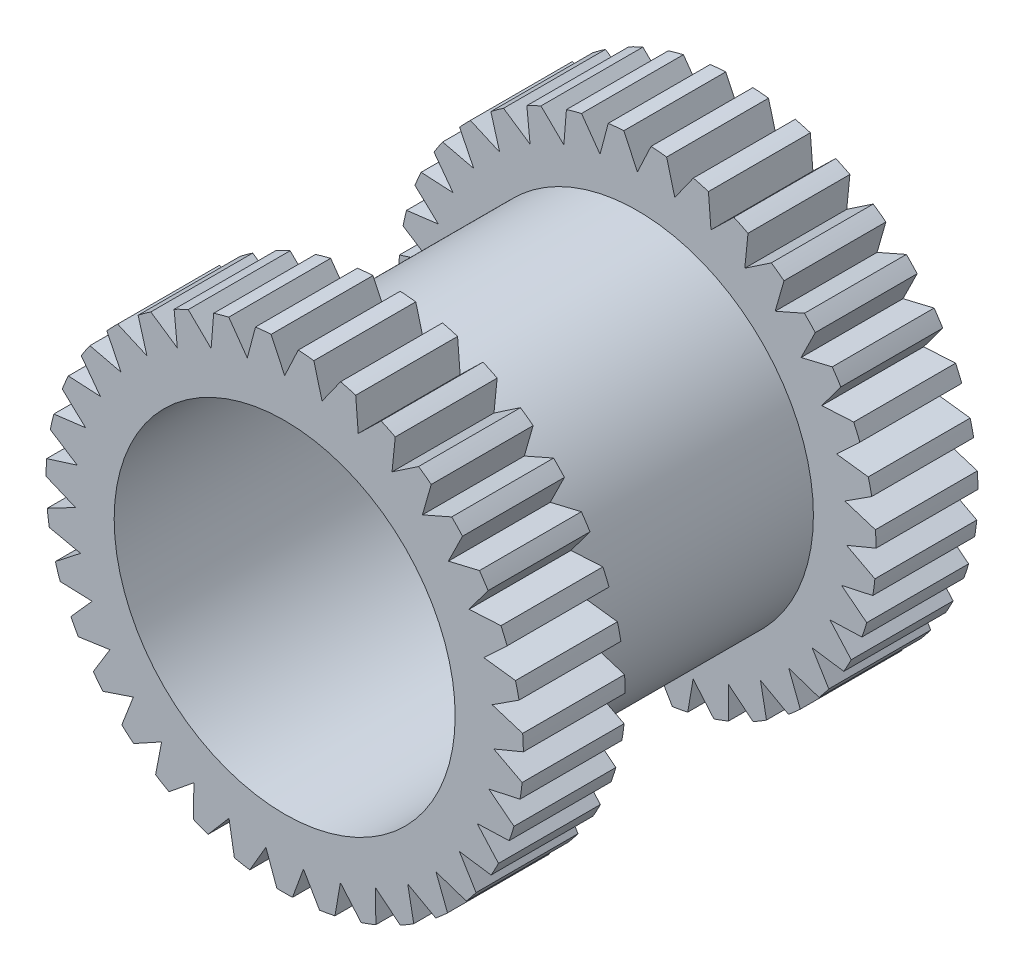
from build123d import *

# Parameters (mm, degrees)
CUT_EXTRUDE1_DEPTH       = 0.65
CUT_EXTRUDE2_DEPTH       = 0.65
CUT_EXTRUDE3_DEPTH       = 0.65
CUT_EXTRUDE4_DEPTH       = 0.65
CUT_EXTRUDE5_DEPTH       = 0.65
CUT_EXTRUDE6_DEPTH       = 0.65
CUT_EXTRUDE7_DEPTH       = 0.65
CUT_EXTRUDE8_DEPTH       = 0.65
CUT_EXTRUDE9_DEPTH       = 0.65
CUT_EXTRUDE10_DEPTH      = 0.65
CUT_EXTRUDE11_DEPTH      = 0.65
CUT_EXTRUDE12_DEPTH      = 0.65
CUT_EXTRUDE13_DEPTH      = 0.65
CUT_EXTRUDE14_DEPTH      = 0.65
CUT_EXTRUDE15_DEPTH      = 0.65
CUT_EXTRUDE16_DEPTH      = 0.65
CUT_EXTRUDE17_DEPTH      = 0.65
CUT_EXTRUDE18_DEPTH      = 0.65
CUT_EXTRUDE19_DEPTH      = 0.65
CUT_EXTRUDE20_DEPTH      = 0.65
CUT_EXTRUDE21_DEPTH      = 0.65
CUT_EXTRUDE22_DEPTH      = 0.65
CUT_EXTRUDE23_DEPTH      = 0.65
CUT_EXTRUDE24_DEPTH      = 0.65
CUT_EXTRUDE25_DEPTH      = 0.65
CUT_EXTRUDE26_DEPTH      = 0.65
CUT_EXTRUDE27_DEPTH      = 0.65
CUT_EXTRUDE28_DEPTH      = 0.65
CUT_EXTRUDE29_DEPTH      = 0.65
CUT_EXTRUDE30_DEPTH      = 0.65
CUT_EXTRUDE31_DEPTH      = 0.65
CUT_EXTRUDE32_DEPTH      = 0.65
CUT_EXTRUDE33_DEPTH      = 0.65
CUT_EXTRUDE34_DEPTH      = 0.65
CUT_EXTRUDE35_DEPTH      = 0.65
CUT_EXTRUDE36_START      = -0.65
CUT_EXTRUDE36_DEPTH      = 0.65
CUT_EXTRUDE37_START      = -0.65
CUT_EXTRUDE37_DEPTH      = 0.65
CUT_EXTRUDE38_START      = -0.65
CUT_EXTRUDE38_DEPTH      = 0.65
CUT_EXTRUDE39_START      = -0.65
CUT_EXTRUDE39_DEPTH      = 0.65
CUT_EXTRUDE40_START      = -0.65
CUT_EXTRUDE40_DEPTH      = 0.65
CUT_EXTRUDE41_START      = -0.65
CUT_EXTRUDE41_DEPTH      = 0.65
CUT_EXTRUDE42_START      = -0.65
CUT_EXTRUDE42_DEPTH      = 0.65
CUT_EXTRUDE43_START      = -0.65
CUT_EXTRUDE43_DEPTH      = 0.65
CUT_EXTRUDE44_START      = -0.65
CUT_EXTRUDE44_DEPTH      = 0.65
CUT_EXTRUDE45_START      = -0.65
CUT_EXTRUDE45_DEPTH      = 0.65
CUT_EXTRUDE46_START      = -0.65
CUT_EXTRUDE46_DEPTH      = 0.65
CUT_EXTRUDE47_START      = -0.65
CUT_EXTRUDE47_DEPTH      = 0.65
CUT_EXTRUDE48_START      = -0.65
CUT_EXTRUDE48_DEPTH      = 0.65
CUT_EXTRUDE49_START      = -0.65
CUT_EXTRUDE49_DEPTH      = 0.65
CUT_EXTRUDE50_START      = -0.65
CUT_EXTRUDE50_DEPTH      = 0.65
CUT_EXTRUDE51_START      = -0.65
CUT_EXTRUDE51_DEPTH      = 0.65
CUT_EXTRUDE52_START      = -0.65
CUT_EXTRUDE52_DEPTH      = 0.65
CUT_EXTRUDE53_START      = -0.65
CUT_EXTRUDE53_DEPTH      = 0.65
CUT_EXTRUDE54_START      = -0.65
CUT_EXTRUDE54_DEPTH      = 0.65
CUT_EXTRUDE55_START      = -0.65
CUT_EXTRUDE55_DEPTH      = 0.65
CUT_EXTRUDE56_START      = -0.65
CUT_EXTRUDE56_DEPTH      = 0.65
CUT_EXTRUDE57_START      = -0.65
CUT_EXTRUDE57_DEPTH      = 0.65
CUT_EXTRUDE58_START      = -0.65
CUT_EXTRUDE58_DEPTH      = 0.65
CUT_EXTRUDE59_START      = -0.65
CUT_EXTRUDE59_DEPTH      = 0.65
CUT_EXTRUDE60_START      = -0.65
CUT_EXTRUDE60_DEPTH      = 0.65
CUT_EXTRUDE61_START      = -0.65
CUT_EXTRUDE61_DEPTH      = 0.65
CUT_EXTRUDE62_START      = -0.65
CUT_EXTRUDE62_DEPTH      = 0.65
CUT_EXTRUDE63_START      = -0.65
CUT_EXTRUDE63_DEPTH      = 0.65
CUT_EXTRUDE64_START      = -0.65
CUT_EXTRUDE64_DEPTH      = 0.65
CUT_EXTRUDE65_START      = -0.65
CUT_EXTRUDE65_DEPTH      = 0.65
CUT_EXTRUDE66_START      = -0.65
CUT_EXTRUDE66_DEPTH      = 0.65
CUT_EXTRUDE67_START      = -0.65
CUT_EXTRUDE67_DEPTH      = 0.65
CUT_EXTRUDE68_START      = -0.65
CUT_EXTRUDE68_DEPTH      = 0.65
CUT_EXTRUDE69_START      = -0.65
CUT_EXTRUDE69_DEPTH      = 0.65
CUT_EXTRUDE70_START      = -0.65
CUT_EXTRUDE70_DEPTH      = 0.65
F_3_0_3_DIAMETER_HOLE1_D = 3
CUT_EXTRUDE71_DEPTH      = 10


with BuildPart() as part:
    # Sketch1 → Revolve1 (revolve)
    with BuildSketch(Plane(origin=(0, 0, 0), x_dir=(1, 0, 0), z_dir=(0, 1, 0))):
        Polygon((2.1, 2), (0, 2), (0, -2), (2.1, -2), (2.1, -1.103448276), (1.548275862, -1.103448276), (1.548275862, 1.103448276), (2.1, 1.103448276), align=None)
    revolve(axis=Axis((0, 0, -2), (0, 0, 1)))

    # Sketch2 → Cut-Extrude1 (cut)
    with BuildSketch(Plane(origin=(0, 0, -2), x_dir=(-1, 0, 0), z_dir=(0, 0, -1))):
        with BuildLine():
            Line((0.673012439, -1.989234591), (0.490007971, -1.775504008))
            Line((0.490007971, -1.775504008), (0.442530268, -2.052843628))
            ThreePointArc((0.442530268, -2.052843628), (0.558677376, -2.024322007), (0.673012439, -1.989234591))
        make_face()
    extrude(amount=-CUT_EXTRUDE1_DEPTH, mode=Mode.SUBTRACT)

    # Sketch3 → Cut-Extrude2 (cut)
    with BuildSketch(Plane(origin=(0, 0, -2), x_dir=(-1, 0, 0), z_dir=(0, 0, -1))):
        with BuildLine():
            Line((0.3070053, -2.077437784), (0.165104859, -1.83446523))
            Line((0.165104859, -1.83446523), (0.068869241, -2.098870417))
            ThreePointArc((0.068869241, -2.098870417), (0.188242549, -2.091546017), (0.3070053, -2.077437784))
        make_face()
    extrude(amount=-CUT_EXTRUDE2_DEPTH, mode=Mode.SUBTRACT)

    # Sketch4 → Cut-Extrude3 (cut)
    with BuildSketch(Plane(origin=(0, 0, -2), x_dir=(-1, 0, 0), z_dir=(0, 0, -1))):
        with BuildLine():
            Line((-0.068869241, -2.098870417), (-0.165104859, -1.83446523))
            Line((-0.165104859, -1.83446523), (-0.3070053, -2.077437784))
            ThreePointArc((-0.3070053, -2.077437784), (-0.188242549, -2.091546017), (-0.068869241, -2.098870417))
        make_face()
    extrude(amount=-CUT_EXTRUDE3_DEPTH, mode=Mode.SUBTRACT)

    # Sketch5 → Cut-Extrude4 (cut)
    with BuildSketch(Plane(origin=(0, 0, -2), x_dir=(-1, 0, 0), z_dir=(0, 0, -1))):
        with BuildLine():
            Line((-0.442530268, -2.052843628), (-0.490007971, -1.775504008))
            Line((-0.490007971, -1.775504008), (-0.673012439, -1.989234591))
            ThreePointArc((-0.673012439, -1.989234591), (-0.558677376, -2.024322007), (-0.442530268, -2.052843628))
        make_face()
    extrude(amount=-CUT_EXTRUDE4_DEPTH, mode=Mode.SUBTRACT)

    # Sketch6 → Cut-Extrude5 (cut)
    with BuildSketch(Plane(origin=(0, 0, -2), x_dir=(-1, 0, 0), z_dir=(0, 0, -1))):
        with BuildLine():
            Line((-0.801968009, -1.940836756), (-0.799161824, -1.659476626))
            Line((-0.799161824, -1.659476626), (-1.017388403, -1.837095761))
            ThreePointArc((-1.017388403, -1.837095761), (-0.911155852, -1.892034623), (-0.801968009, -1.940836756))
        make_face()
    extrude(amount=-CUT_EXTRUDE5_DEPTH, mode=Mode.SUBTRACT)

    # Sketch7 → Cut-Extrude6 (cut)
    with BuildSketch(Plane(origin=(0, 0, -2), x_dir=(-1, 0, 0), z_dir=(0, 0, -1))):
        with BuildLine():
            Line((-1.135629837, -1.766449794), (-1.082629958, -1.4901123))
            Line((-1.082629958, -1.4901123), (-1.329064668, -1.625911163))
            ThreePointArc((-1.329064668, -1.625911163), (-1.23434903, -1.698935688), (-1.135629837, -1.766449794))
        make_face()
    extrude(amount=-CUT_EXTRUDE6_DEPTH, mode=Mode.SUBTRACT)

    # Sketch8 → Cut-Extrude7 (cut)
    with BuildSketch(Plane(origin=(0, 0, -2), x_dir=(-1, 0, 0), z_dir=(0, 0, -1))):
        with BuildLine():
            Line((-1.432791588, -1.535287681), (-1.331301474, -1.272854539))
            Line((-1.331301474, -1.272854539), (-1.5980237, -1.362468441))
            ThreePointArc((-1.5980237, -1.362468441), (-1.517869214, -1.451231563), (-1.432791588, -1.535287681))
        make_face()
    extrude(amount=-CUT_EXTRUDE7_DEPTH, mode=Mode.SUBTRACT)

    # Sketch9 → Cut-Extrude8 (cut)
    with BuildSketch(Plane(origin=(0, 0, -2), x_dir=(-1, 0, 0), z_dir=(0, 0, -1))):
        with BuildLine():
            Line((-1.683902239, -1.25478016), (-1.537183866, -1.014686186))
            Line((-1.537183866, -1.014686186), (-1.815620936, -1.055234863))
            ThreePointArc((-1.815620936, -1.055234863), (-1.752603833, -1.156883661), (-1.683902239, -1.25478016))
        make_face()
    extrude(amount=-CUT_EXTRUDE8_DEPTH, mode=Mode.SUBTRACT)

    # Sketch10 → Cut-Extrude9 (cut)
    with BuildSketch(Plane(origin=(0, 0, -2), x_dir=(-1, 0, 0), z_dir=(0, 0, -1))):
        with BuildLine():
            Line((-1.880890886, -0.933942971), (-1.693659903, -0.723904984))
            Line((-1.693659903, -0.723904984), (-1.974862621, -0.714085168))
            ThreePointArc((-1.974862621, -0.714085168), (-1.931008322, -0.825352566), (-1.880890886, -0.933942971))
        make_face()
    extrude(amount=-CUT_EXTRUDE9_DEPTH, mode=Mode.SUBTRACT)

    # Sketch11 → Cut-Extrude10 (cut)
    with BuildSketch(Plane(origin=(0, 0, -2), x_dir=(-1, 0, 0), z_dir=(0, 0, -1))):
        with BuildLine():
            Line((-2.017426153, -0.583088087), (-1.795700318, -0.40985688))
            Line((-1.795700318, -0.40985688), (-2.070630597, -0.349984189))
            ThreePointArc((-2.070630597, -0.349984189), (-2.047348616, -0.467293961), (-2.017426153, -0.583088087))
        make_face()
    extrude(amount=-CUT_EXTRUDE10_DEPTH, mode=Mode.SUBTRACT)

    # Sketch12 → Cut-Extrude11 (cut)
    with BuildSketch(Plane(origin=(0, 0, -2), x_dir=(-1, 0, 0), z_dir=(0, 0, -1))):
        with BuildLine():
            Line((-2.089119683, -0.213492273), (-1.840025447, -0.082635638))
            Line((-1.840025447, -0.082635638), (-2.099846801, 0.025365571))
            ThreePointArc((-2.099846801, 0.025365571), (-2.09788544, -0.094216144), (-2.089119683, -0.213492273))
        make_face()
    extrude(amount=-CUT_EXTRUDE11_DEPTH, mode=Mode.SUBTRACT)

    # Sketch13 → Cut-Extrude12 (cut)
    with BuildSketch(Plane(origin=(0, 0, -2), x_dir=(-1, 0, 0), z_dir=(0, 0, -1))):
        with BuildLine():
            Line((-2.093667187, 0.162965359), (-1.825210644, 0.247241581))
            Line((-1.825210644, 0.247241581), (-2.061572201, 0.39990006))
            ThreePointArc((-2.061572201, 0.39990006), (-2.0809945, 0.281889858), (-2.093667187, 0.162965359))
        make_face()
    extrude(amount=-CUT_EXTRUDE12_DEPTH, mode=Mode.SUBTRACT)

    # Sketch14 → Cut-Extrude13 (cut)
    with BuildSketch(Plane(origin=(0, 0, -2), x_dir=(-1, 0, 0), z_dir=(0, 0, -1))):
        with BuildLine():
            Line((-2.030922506, 0.534185151), (-1.751732069, 0.569172252))
            Line((-1.751732069, 0.569172252), (-1.957036975, 0.761581432))
            ThreePointArc((-1.957036975, 0.761581432), (-1.997218684, 0.648935688), (-2.030922506, 0.534185151))
        make_face()
    extrude(amount=-CUT_EXTRUDE13_DEPTH, mode=Mode.SUBTRACT)

    # Sketch15 → Cut-Extrude14 (cut)
    with BuildSketch(Plane(origin=(0, 0, -2), x_dir=(-1, 0, 0), z_dir=(0, 0, -1))):
        with BuildLine():
            Line((-1.902902304, 0.888235792), (-1.621951384, 0.872809258))
            Line((-1.621951384, 0.872809258), (-1.78960097, 1.098784951))
            ThreePointArc((-1.78960097, 1.098784951), (-1.849250617, 0.995124191), (-1.902902304, 0.888235792))
        make_face()
    extrude(amount=-CUT_EXTRUDE14_DEPTH, mode=Mode.SUBTRACT)

    # Sketch16 → Cut-Extrude15 (cut)
    with BuildSketch(Plane(origin=(0, 0, -2), x_dir=(-1, 0, 0), z_dir=(0, 0, -1))):
        with BuildLine():
            Line((-1.713721256, 1.213737804), (-1.440039847, 1.148393457))
            Line((-1.440039847, 1.148393457), (-1.564645717, 1.400672617))
            ThreePointArc((-1.564645717, 1.400672617), (-1.641846113, 1.309328584), (-1.713721256, 1.213737804))
        make_face()
    extrude(amount=-CUT_EXTRUDE15_DEPTH, mode=Mode.SUBTRACT)

    # Sketch17 → Cut-Extrude16 (cut)
    with BuildSketch(Plane(origin=(0, 0, -2), x_dir=(-1, 0, 0), z_dir=(0, 0, -1))):
        with BuildLine():
            Line((-1.469459797, 1.500229284), (-1.211844245, 1.387067345))
            Line((-1.211844245, 1.387067345), (-1.289401464, 1.657541512))
            ThreePointArc((-1.289401464, 1.657541512), (-1.381671324, 1.581450079), (-1.469459797, 1.500229284))
        make_face()
    extrude(amount=-CUT_EXTRUDE16_DEPTH, mode=Mode.SUBTRACT)

    # Sketch18 → Cut-Extrude17 (cut)
    with BuildSketch(Plane(origin=(0, 0, -2), x_dir=(-1, 0, 0), z_dir=(0, 0, -1))):
        with BuildLine():
            Line((-1.177968691, 1.738502161), (-0.944698971, 1.581159748))
            Line((-0.944698971, 1.581159748), (-0.972714787, 1.86113566))
            ThreePointArc((-0.972714787, 1.86113566), (-1.077088483, 1.802742467), (-1.177968691, 1.738502161))
        make_face()
    extrude(amount=-CUT_EXTRUDE17_DEPTH, mode=Mode.SUBTRACT)

    # Sketch19 → Cut-Extrude18 (cut)
    with BuildSketch(Plane(origin=(0, 0, -2), x_dir=(-1, 0, 0), z_dir=(0, 0, -1))):
        with BuildLine():
            Line((-0.848616702, 1.920898147), (-0.647190295, 1.724432375))
            Line((-0.647190295, 1.724432375), (-0.624764256, 2.004911376))
            ThreePointArc((-0.624764256, 2.004911376), (-0.737887131, 1.966093228), (-0.848616702, 1.920898147))
        make_face()
    extrude(amount=-CUT_EXTRUDE18_DEPTH, mode=Mode.SUBTRACT)

    # Sketch20 → Cut-Extrude19 (cut)
    with BuildSketch(Plane(origin=(0, 0, -2), x_dir=(-1, 0, 0), z_dir=(0, 0, -1))):
        with BuildLine():
            Line((-0.491989474, 2.041554887), (-0.328880391, 1.812280327))
            Line((-0.328880391, 1.812280327), (-0.256733287, 2.084247591))
            ThreePointArc((-0.256733287, 2.084247591), (-0.374969479, 2.066252136), (-0.491989474, 2.041554887))
        make_face()
    extrude(amount=-CUT_EXTRUDE19_DEPTH, mode=Mode.SUBTRACT)

    # Sketch21 → Cut-Extrude20 (cut)
    with BuildSketch(Plane(origin=(0, 0, -2), x_dir=(-1, 0, 0), z_dir=(0, 0, -1))):
        with BuildLine():
            Line((-0.1195493, 2.096594373), (0, 1.841880097))
            Line((0, 1.841880097), (0.1195493, 2.096594373))
            ThreePointArc((0.1195493, 2.096594373), (0, 2.1), (-0.1195493, 2.096594373))
        make_face()
    extrude(amount=-CUT_EXTRUDE20_DEPTH, mode=Mode.SUBTRACT)

    # Sketch22 → Cut-Extrude21 (cut)
    with BuildSketch(Plane(origin=(0, 0, -2), x_dir=(-1, 0, 0), z_dir=(0, 0, -1))):
        with BuildLine():
            Line((0.256733287, 2.084247591), (0.328880391, 1.812280327))
            Line((0.328880391, 1.812280327), (0.491989474, 2.041554887))
            ThreePointArc((0.491989474, 2.041554887), (0.374969479, 2.066252136), (0.256733287, 2.084247591))
        make_face()
    extrude(amount=-CUT_EXTRUDE21_DEPTH, mode=Mode.SUBTRACT)

    # Sketch23 → Cut-Extrude22 (cut)
    with BuildSketch(Plane(origin=(0, 0, -2), x_dir=(-1, 0, 0), z_dir=(0, 0, -1))):
        with BuildLine():
            Line((0.624764256, 2.004911376), (0.647190295, 1.724432375))
            Line((0.647190295, 1.724432375), (0.848616702, 1.920898147))
            ThreePointArc((0.848616702, 1.920898147), (0.737887131, 1.966093228), (0.624764256, 2.004911376))
        make_face()
    extrude(amount=-CUT_EXTRUDE22_DEPTH, mode=Mode.SUBTRACT)

    # Sketch24 → Cut-Extrude23 (cut)
    with BuildSketch(Plane(origin=(0, 0, -2), x_dir=(-1, 0, 0), z_dir=(0, 0, -1))):
        with BuildLine():
            Line((0.972714787, 1.86113566), (0.944698971, 1.581159748))
            Line((0.944698971, 1.581159748), (1.177968691, 1.738502161))
            ThreePointArc((1.177968691, 1.738502161), (1.077088483, 1.802742467), (0.972714787, 1.86113566))
        make_face()
    extrude(amount=-CUT_EXTRUDE23_DEPTH, mode=Mode.SUBTRACT)

    # Sketch25 → Cut-Extrude24 (cut)
    with BuildSketch(Plane(origin=(0, 0, -2), x_dir=(-1, 0, 0), z_dir=(0, 0, -1))):
        with BuildLine():
            Line((1.289401464, 1.657541512), (1.211844245, 1.387067345))
            Line((1.211844245, 1.387067345), (1.469459797, 1.500229284))
            ThreePointArc((1.469459797, 1.500229284), (1.381671324, 1.581450079), (1.289401464, 1.657541512))
        make_face()
    extrude(amount=-CUT_EXTRUDE24_DEPTH, mode=Mode.SUBTRACT)

    # Sketch26 → Cut-Extrude25 (cut)
    with BuildSketch(Plane(origin=(0, 0, -2), x_dir=(-1, 0, 0), z_dir=(0, 0, -1))):
        with BuildLine():
            Line((1.564645717, 1.400672617), (1.440039847, 1.148393457))
            Line((1.440039847, 1.148393457), (1.713721256, 1.213737804))
            ThreePointArc((1.713721256, 1.213737804), (1.641846113, 1.309328584), (1.564645717, 1.400672617))
        make_face()
    extrude(amount=-CUT_EXTRUDE25_DEPTH, mode=Mode.SUBTRACT)

    # Sketch27 → Cut-Extrude26 (cut)
    with BuildSketch(Plane(origin=(0, 0, -2), x_dir=(-1, 0, 0), z_dir=(0, 0, -1))):
        with BuildLine():
            Line((1.78960097, 1.098784951), (1.621951384, 0.872809258))
            Line((1.621951384, 0.872809258), (1.902902304, 0.888235792))
            ThreePointArc((1.902902304, 0.888235792), (1.849250617, 0.995124191), (1.78960097, 1.098784951))
        make_face()
    extrude(amount=-CUT_EXTRUDE26_DEPTH, mode=Mode.SUBTRACT)

    # Sketch28 → Cut-Extrude27 (cut)
    with BuildSketch(Plane(origin=(0, 0, -2), x_dir=(-1, 0, 0), z_dir=(0, 0, -1))):
        with BuildLine():
            Line((1.957036975, 0.761581432), (1.751732069, 0.569172252))
            Line((1.751732069, 0.569172252), (2.030922506, 0.534185151))
            ThreePointArc((2.030922506, 0.534185151), (1.997218684, 0.648935688), (1.957036975, 0.761581432))
        make_face()
    extrude(amount=-CUT_EXTRUDE27_DEPTH, mode=Mode.SUBTRACT)

    # Sketch29 → Cut-Extrude28 (cut)
    with BuildSketch(Plane(origin=(0, 0, -2), x_dir=(-1, 0, 0), z_dir=(0, 0, -1))):
        with BuildLine():
            Line((2.061572201, 0.39990006), (1.825210644, 0.247241581))
            Line((1.825210644, 0.247241581), (2.093667187, 0.162965359))
            ThreePointArc((2.093667187, 0.162965359), (2.0809945, 0.281889858), (2.061572201, 0.39990006))
        make_face()
    extrude(amount=-CUT_EXTRUDE28_DEPTH, mode=Mode.SUBTRACT)

    # Sketch30 → Cut-Extrude29 (cut)
    with BuildSketch(Plane(origin=(0, 0, -2), x_dir=(-1, 0, 0), z_dir=(0, 0, -1))):
        with BuildLine():
            Line((2.099846801, 0.025365571), (1.840025447, -0.082635638))
            Line((1.840025447, -0.082635638), (2.089119683, -0.213492273))
            ThreePointArc((2.089119683, -0.213492273), (2.09788544, -0.094216144), (2.099846801, 0.025365571))
        make_face()
    extrude(amount=-CUT_EXTRUDE29_DEPTH, mode=Mode.SUBTRACT)

    # Sketch31 → Cut-Extrude30 (cut)
    with BuildSketch(Plane(origin=(0, 0, -2), x_dir=(-1, 0, 0), z_dir=(0, 0, -1))):
        with BuildLine():
            Line((2.070630597, -0.349984189), (1.795700318, -0.40985688))
            Line((1.795700318, -0.40985688), (2.017426153, -0.583088087))
            ThreePointArc((2.017426153, -0.583088087), (2.047348616, -0.467293961), (2.070630597, -0.349984189))
        make_face()
    extrude(amount=-CUT_EXTRUDE30_DEPTH, mode=Mode.SUBTRACT)

    # Sketch32 → Cut-Extrude31 (cut)
    with BuildSketch(Plane(origin=(0, 0, -2), x_dir=(-1, 0, 0), z_dir=(0, 0, -1))):
        with BuildLine():
            Line((1.974862621, -0.714085168), (1.693659903, -0.723904984))
            Line((1.693659903, -0.723904984), (1.880890886, -0.933942971))
            ThreePointArc((1.880890886, -0.933942971), (1.931008322, -0.825352566), (1.974862621, -0.714085168))
        make_face()
    extrude(amount=-CUT_EXTRUDE31_DEPTH, mode=Mode.SUBTRACT)

    # Sketch33 → Cut-Extrude32 (cut)
    with BuildSketch(Plane(origin=(0, 0, -2), x_dir=(-1, 0, 0), z_dir=(0, 0, -1))):
        with BuildLine():
            Line((1.815620936, -1.055234863), (1.537183866, -1.014686186))
            Line((1.537183866, -1.014686186), (1.683902239, -1.25478016))
            ThreePointArc((1.683902239, -1.25478016), (1.752603833, -1.156883661), (1.815620936, -1.055234863))
        make_face()
    extrude(amount=-CUT_EXTRUDE32_DEPTH, mode=Mode.SUBTRACT)

    # Sketch34 → Cut-Extrude33 (cut)
    with BuildSketch(Plane(origin=(0, 0, -2), x_dir=(-1, 0, 0), z_dir=(0, 0, -1))):
        with BuildLine():
            Line((1.5980237, -1.362468441), (1.331301474, -1.272854539))
            Line((1.331301474, -1.272854539), (1.432791588, -1.535287681))
            ThreePointArc((1.432791588, -1.535287681), (1.517869214, -1.451231563), (1.5980237, -1.362468441))
        make_face()
    extrude(amount=-CUT_EXTRUDE33_DEPTH, mode=Mode.SUBTRACT)

    # Sketch35 → Cut-Extrude34 (cut)
    with BuildSketch(Plane(origin=(0, 0, -2), x_dir=(-1, 0, 0), z_dir=(0, 0, -1))):
        with BuildLine():
            Line((1.329064668, -1.625911163), (1.082629958, -1.4901123))
            Line((1.082629958, -1.4901123), (1.135629837, -1.766449794))
            ThreePointArc((1.135629837, -1.766449794), (1.23434903, -1.698935688), (1.329064668, -1.625911163))
        make_face()
    extrude(amount=-CUT_EXTRUDE34_DEPTH, mode=Mode.SUBTRACT)

    # Sketch36 → Cut-Extrude35 (cut)
    with BuildSketch(Plane(origin=(0, 0, -2), x_dir=(-1, 0, 0), z_dir=(0, 0, -1))):
        with BuildLine():
            Line((1.017388403, -1.837095761), (0.799161824, -1.659476626))
            Line((0.799161824, -1.659476626), (0.801968009, -1.940836756))
            ThreePointArc((0.801968009, -1.940836756), (0.911155852, -1.892034623), (1.017388403, -1.837095761))
        make_face()
    extrude(amount=-CUT_EXTRUDE35_DEPTH, mode=Mode.SUBTRACT)

    # Sketch37 → Cut-Extrude36 (cut)
    with BuildSketch(Plane.XY.offset(2).offset(CUT_EXTRUDE36_START)):
        with BuildLine():
            Line((-0.442530268, -2.052843628), (-0.490007971, -1.775504008))
            Line((-0.490007971, -1.775504008), (-0.673012439, -1.989234591))
            ThreePointArc((-0.673012439, -1.989234591), (-0.558677376, -2.024322007), (-0.442530268, -2.052843628))
        make_face()
    extrude(amount=CUT_EXTRUDE36_DEPTH, mode=Mode.SUBTRACT)

    # Sketch38 → Cut-Extrude37 (cut)
    with BuildSketch(Plane.XY.offset(2).offset(CUT_EXTRUDE37_START)):
        with BuildLine():
            Line((-0.801968009, -1.940836756), (-0.799161824, -1.659476626))
            Line((-0.799161824, -1.659476626), (-1.017388403, -1.837095761))
            ThreePointArc((-1.017388403, -1.837095761), (-0.911155852, -1.892034623), (-0.801968009, -1.940836756))
        make_face()
    extrude(amount=CUT_EXTRUDE37_DEPTH, mode=Mode.SUBTRACT)

    # Sketch39 → Cut-Extrude38 (cut)
    with BuildSketch(Plane.XY.offset(2).offset(CUT_EXTRUDE38_START)):
        with BuildLine():
            Line((-1.135629837, -1.766449794), (-1.082629958, -1.4901123))
            Line((-1.082629958, -1.4901123), (-1.329064668, -1.625911163))
            ThreePointArc((-1.329064668, -1.625911163), (-1.23434903, -1.698935688), (-1.135629837, -1.766449794))
        make_face()
    extrude(amount=CUT_EXTRUDE38_DEPTH, mode=Mode.SUBTRACT)

    # Sketch40 → Cut-Extrude39 (cut)
    with BuildSketch(Plane.XY.offset(2).offset(CUT_EXTRUDE39_START)):
        with BuildLine():
            Line((-1.432791588, -1.535287681), (-1.331301474, -1.272854539))
            Line((-1.331301474, -1.272854539), (-1.5980237, -1.362468441))
            ThreePointArc((-1.5980237, -1.362468441), (-1.517869214, -1.451231563), (-1.432791588, -1.535287681))
        make_face()
    extrude(amount=CUT_EXTRUDE39_DEPTH, mode=Mode.SUBTRACT)

    # Sketch41 → Cut-Extrude40 (cut)
    with BuildSketch(Plane.XY.offset(2).offset(CUT_EXTRUDE40_START)):
        with BuildLine():
            Line((-1.683902239, -1.25478016), (-1.537183866, -1.014686186))
            Line((-1.537183866, -1.014686186), (-1.815620936, -1.055234863))
            ThreePointArc((-1.815620936, -1.055234863), (-1.752603833, -1.156883661), (-1.683902239, -1.25478016))
        make_face()
    extrude(amount=CUT_EXTRUDE40_DEPTH, mode=Mode.SUBTRACT)

    # Sketch42 → Cut-Extrude41 (cut)
    with BuildSketch(Plane.XY.offset(2).offset(CUT_EXTRUDE41_START)):
        with BuildLine():
            Line((-1.880890886, -0.933942971), (-1.693659903, -0.723904984))
            Line((-1.693659903, -0.723904984), (-1.974862621, -0.714085168))
            ThreePointArc((-1.974862621, -0.714085168), (-1.931008322, -0.825352566), (-1.880890886, -0.933942971))
        make_face()
    extrude(amount=CUT_EXTRUDE41_DEPTH, mode=Mode.SUBTRACT)

    # Sketch43 → Cut-Extrude42 (cut)
    with BuildSketch(Plane.XY.offset(2).offset(CUT_EXTRUDE42_START)):
        with BuildLine():
            Line((-2.017426153, -0.583088087), (-1.795700318, -0.40985688))
            Line((-1.795700318, -0.40985688), (-2.070630597, -0.349984189))
            ThreePointArc((-2.070630597, -0.349984189), (-2.047348616, -0.467293961), (-2.017426153, -0.583088087))
        make_face()
    extrude(amount=CUT_EXTRUDE42_DEPTH, mode=Mode.SUBTRACT)

    # Sketch44 → Cut-Extrude43 (cut)
    with BuildSketch(Plane.XY.offset(2).offset(CUT_EXTRUDE43_START)):
        with BuildLine():
            Line((-2.089119683, -0.213492273), (-1.840025447, -0.082635638))
            Line((-1.840025447, -0.082635638), (-2.099846801, 0.025365571))
            ThreePointArc((-2.099846801, 0.025365571), (-2.09788544, -0.094216144), (-2.089119683, -0.213492273))
        make_face()
    extrude(amount=CUT_EXTRUDE43_DEPTH, mode=Mode.SUBTRACT)

    # Sketch45 → Cut-Extrude44 (cut)
    with BuildSketch(Plane.XY.offset(2).offset(CUT_EXTRUDE44_START)):
        with BuildLine():
            Line((-2.093667187, 0.162965359), (-1.825210644, 0.247241581))
            Line((-1.825210644, 0.247241581), (-2.061572201, 0.39990006))
            ThreePointArc((-2.061572201, 0.39990006), (-2.0809945, 0.281889858), (-2.093667187, 0.162965359))
        make_face()
    extrude(amount=CUT_EXTRUDE44_DEPTH, mode=Mode.SUBTRACT)

    # Sketch46 → Cut-Extrude45 (cut)
    with BuildSketch(Plane.XY.offset(2).offset(CUT_EXTRUDE45_START)):
        with BuildLine():
            Line((-2.030922506, 0.534185151), (-1.751732069, 0.569172252))
            Line((-1.751732069, 0.569172252), (-1.957036975, 0.761581432))
            ThreePointArc((-1.957036975, 0.761581432), (-1.997218684, 0.648935688), (-2.030922506, 0.534185151))
        make_face()
    extrude(amount=CUT_EXTRUDE45_DEPTH, mode=Mode.SUBTRACT)

    # Sketch47 → Cut-Extrude46 (cut)
    with BuildSketch(Plane.XY.offset(2).offset(CUT_EXTRUDE46_START)):
        with BuildLine():
            Line((-1.902902304, 0.888235792), (-1.621951384, 0.872809258))
            Line((-1.621951384, 0.872809258), (-1.78960097, 1.098784951))
            ThreePointArc((-1.78960097, 1.098784951), (-1.849250617, 0.995124191), (-1.902902304, 0.888235792))
        make_face()
    extrude(amount=CUT_EXTRUDE46_DEPTH, mode=Mode.SUBTRACT)

    # Sketch48 → Cut-Extrude47 (cut)
    with BuildSketch(Plane.XY.offset(2).offset(CUT_EXTRUDE47_START)):
        with BuildLine():
            Line((-1.713721256, 1.213737804), (-1.440039847, 1.148393457))
            Line((-1.440039847, 1.148393457), (-1.564645717, 1.400672617))
            ThreePointArc((-1.564645717, 1.400672617), (-1.641846113, 1.309328584), (-1.713721256, 1.213737804))
        make_face()
    extrude(amount=CUT_EXTRUDE47_DEPTH, mode=Mode.SUBTRACT)

    # Sketch49 → Cut-Extrude48 (cut)
    with BuildSketch(Plane.XY.offset(2).offset(CUT_EXTRUDE48_START)):
        with BuildLine():
            Line((-1.469459797, 1.500229284), (-1.211844245, 1.387067345))
            Line((-1.211844245, 1.387067345), (-1.289401464, 1.657541512))
            ThreePointArc((-1.289401464, 1.657541512), (-1.381671324, 1.581450079), (-1.469459797, 1.500229284))
        make_face()
    extrude(amount=CUT_EXTRUDE48_DEPTH, mode=Mode.SUBTRACT)

    # Sketch50 → Cut-Extrude49 (cut)
    with BuildSketch(Plane.XY.offset(2).offset(CUT_EXTRUDE49_START)):
        with BuildLine():
            Line((-1.177968691, 1.738502161), (-0.944698971, 1.581159748))
            Line((-0.944698971, 1.581159748), (-0.972714787, 1.86113566))
            ThreePointArc((-0.972714787, 1.86113566), (-1.077088483, 1.802742467), (-1.177968691, 1.738502161))
        make_face()
    extrude(amount=CUT_EXTRUDE49_DEPTH, mode=Mode.SUBTRACT)

    # Sketch51 → Cut-Extrude50 (cut)
    with BuildSketch(Plane.XY.offset(2).offset(CUT_EXTRUDE50_START)):
        with BuildLine():
            Line((-0.848616702, 1.920898147), (-0.647190295, 1.724432375))
            Line((-0.647190295, 1.724432375), (-0.624764256, 2.004911376))
            ThreePointArc((-0.624764256, 2.004911376), (-0.737887131, 1.966093228), (-0.848616702, 1.920898147))
        make_face()
    extrude(amount=CUT_EXTRUDE50_DEPTH, mode=Mode.SUBTRACT)

    # Sketch52 → Cut-Extrude51 (cut)
    with BuildSketch(Plane.XY.offset(2).offset(CUT_EXTRUDE51_START)):
        with BuildLine():
            Line((-0.491989474, 2.041554887), (-0.328880391, 1.812280327))
            Line((-0.328880391, 1.812280327), (-0.256733287, 2.084247591))
            ThreePointArc((-0.256733287, 2.084247591), (-0.374969479, 2.066252136), (-0.491989474, 2.041554887))
        make_face()
    extrude(amount=CUT_EXTRUDE51_DEPTH, mode=Mode.SUBTRACT)

    # Sketch53 → Cut-Extrude52 (cut)
    with BuildSketch(Plane.XY.offset(2).offset(CUT_EXTRUDE52_START)):
        with BuildLine():
            Line((-0.1195493, 2.096594373), (0, 1.841880097))
            Line((0, 1.841880097), (0.1195493, 2.096594373))
            ThreePointArc((0.1195493, 2.096594373), (0, 2.1), (-0.1195493, 2.096594373))
        make_face()
    extrude(amount=CUT_EXTRUDE52_DEPTH, mode=Mode.SUBTRACT)

    # Sketch54 → Cut-Extrude53 (cut)
    with BuildSketch(Plane.XY.offset(2).offset(CUT_EXTRUDE53_START)):
        with BuildLine():
            Line((0.256733287, 2.084247591), (0.328880391, 1.812280327))
            Line((0.328880391, 1.812280327), (0.491989474, 2.041554887))
            ThreePointArc((0.491989474, 2.041554887), (0.374969479, 2.066252136), (0.256733287, 2.084247591))
        make_face()
    extrude(amount=CUT_EXTRUDE53_DEPTH, mode=Mode.SUBTRACT)

    # Sketch55 → Cut-Extrude54 (cut)
    with BuildSketch(Plane.XY.offset(2).offset(CUT_EXTRUDE54_START)):
        with BuildLine():
            Line((0.624764256, 2.004911376), (0.647190295, 1.724432375))
            Line((0.647190295, 1.724432375), (0.848616702, 1.920898147))
            ThreePointArc((0.848616702, 1.920898147), (0.737887131, 1.966093228), (0.624764256, 2.004911376))
        make_face()
    extrude(amount=CUT_EXTRUDE54_DEPTH, mode=Mode.SUBTRACT)

    # Sketch56 → Cut-Extrude55 (cut)
    with BuildSketch(Plane.XY.offset(2).offset(CUT_EXTRUDE55_START)):
        with BuildLine():
            Line((0.972714787, 1.86113566), (0.944698971, 1.581159748))
            Line((0.944698971, 1.581159748), (1.177968691, 1.738502161))
            ThreePointArc((1.177968691, 1.738502161), (1.077088483, 1.802742467), (0.972714787, 1.86113566))
        make_face()
    extrude(amount=CUT_EXTRUDE55_DEPTH, mode=Mode.SUBTRACT)

    # Sketch57 → Cut-Extrude56 (cut)
    with BuildSketch(Plane.XY.offset(2).offset(CUT_EXTRUDE56_START)):
        with BuildLine():
            Line((1.289401464, 1.657541512), (1.211844245, 1.387067345))
            Line((1.211844245, 1.387067345), (1.469459797, 1.500229284))
            ThreePointArc((1.469459797, 1.500229284), (1.381671324, 1.581450079), (1.289401464, 1.657541512))
        make_face()
    extrude(amount=CUT_EXTRUDE56_DEPTH, mode=Mode.SUBTRACT)

    # Sketch58 → Cut-Extrude57 (cut)
    with BuildSketch(Plane.XY.offset(2).offset(CUT_EXTRUDE57_START)):
        with BuildLine():
            Line((1.564645717, 1.400672617), (1.440039847, 1.148393457))
            Line((1.440039847, 1.148393457), (1.713721256, 1.213737804))
            ThreePointArc((1.713721256, 1.213737804), (1.641846113, 1.309328584), (1.564645717, 1.400672617))
        make_face()
    extrude(amount=CUT_EXTRUDE57_DEPTH, mode=Mode.SUBTRACT)

    # Sketch59 → Cut-Extrude58 (cut)
    with BuildSketch(Plane.XY.offset(2).offset(CUT_EXTRUDE58_START)):
        with BuildLine():
            Line((1.78960097, 1.098784951), (1.621951384, 0.872809258))
            Line((1.621951384, 0.872809258), (1.902902304, 0.888235792))
            ThreePointArc((1.902902304, 0.888235792), (1.849250617, 0.995124191), (1.78960097, 1.098784951))
        make_face()
    extrude(amount=CUT_EXTRUDE58_DEPTH, mode=Mode.SUBTRACT)

    # Sketch60 → Cut-Extrude59 (cut)
    with BuildSketch(Plane.XY.offset(2).offset(CUT_EXTRUDE59_START)):
        with BuildLine():
            Line((1.957036975, 0.761581432), (1.751732069, 0.569172252))
            Line((1.751732069, 0.569172252), (2.030922506, 0.534185151))
            ThreePointArc((2.030922506, 0.534185151), (1.997218684, 0.648935688), (1.957036975, 0.761581432))
        make_face()
    extrude(amount=CUT_EXTRUDE59_DEPTH, mode=Mode.SUBTRACT)

    # Sketch61 → Cut-Extrude60 (cut)
    with BuildSketch(Plane.XY.offset(2).offset(CUT_EXTRUDE60_START)):
        with BuildLine():
            Line((2.061572201, 0.39990006), (1.825210644, 0.247241581))
            Line((1.825210644, 0.247241581), (2.093667187, 0.162965359))
            ThreePointArc((2.093667187, 0.162965359), (2.0809945, 0.281889858), (2.061572201, 0.39990006))
        make_face()
    extrude(amount=CUT_EXTRUDE60_DEPTH, mode=Mode.SUBTRACT)

    # Sketch62 → Cut-Extrude61 (cut)
    with BuildSketch(Plane.XY.offset(2).offset(CUT_EXTRUDE61_START)):
        with BuildLine():
            Line((2.099846801, 0.025365571), (1.840025447, -0.082635638))
            Line((1.840025447, -0.082635638), (2.089119683, -0.213492273))
            ThreePointArc((2.089119683, -0.213492273), (2.09788544, -0.094216144), (2.099846801, 0.025365571))
        make_face()
    extrude(amount=CUT_EXTRUDE61_DEPTH, mode=Mode.SUBTRACT)

    # Sketch63 → Cut-Extrude62 (cut)
    with BuildSketch(Plane.XY.offset(2).offset(CUT_EXTRUDE62_START)):
        with BuildLine():
            Line((2.070630597, -0.349984189), (1.795700318, -0.40985688))
            Line((1.795700318, -0.40985688), (2.017426153, -0.583088087))
            ThreePointArc((2.017426153, -0.583088087), (2.047348616, -0.467293961), (2.070630597, -0.349984189))
        make_face()
    extrude(amount=CUT_EXTRUDE62_DEPTH, mode=Mode.SUBTRACT)

    # Sketch64 → Cut-Extrude63 (cut)
    with BuildSketch(Plane.XY.offset(2).offset(CUT_EXTRUDE63_START)):
        with BuildLine():
            Line((1.974862621, -0.714085168), (1.693659903, -0.723904984))
            Line((1.693659903, -0.723904984), (1.880890886, -0.933942971))
            ThreePointArc((1.880890886, -0.933942971), (1.931008322, -0.825352566), (1.974862621, -0.714085168))
        make_face()
    extrude(amount=CUT_EXTRUDE63_DEPTH, mode=Mode.SUBTRACT)

    # Sketch65 → Cut-Extrude64 (cut)
    with BuildSketch(Plane.XY.offset(2).offset(CUT_EXTRUDE64_START)):
        with BuildLine():
            Line((1.815620936, -1.055234863), (1.537183866, -1.014686186))
            Line((1.537183866, -1.014686186), (1.683902239, -1.25478016))
            ThreePointArc((1.683902239, -1.25478016), (1.752603833, -1.156883661), (1.815620936, -1.055234863))
        make_face()
    extrude(amount=CUT_EXTRUDE64_DEPTH, mode=Mode.SUBTRACT)

    # Sketch66 → Cut-Extrude65 (cut)
    with BuildSketch(Plane.XY.offset(2).offset(CUT_EXTRUDE65_START)):
        with BuildLine():
            Line((1.5980237, -1.362468441), (1.331301474, -1.272854539))
            Line((1.331301474, -1.272854539), (1.432791588, -1.535287681))
            ThreePointArc((1.432791588, -1.535287681), (1.517869214, -1.451231563), (1.5980237, -1.362468441))
        make_face()
    extrude(amount=CUT_EXTRUDE65_DEPTH, mode=Mode.SUBTRACT)

    # Sketch67 → Cut-Extrude66 (cut)
    with BuildSketch(Plane.XY.offset(2).offset(CUT_EXTRUDE66_START)):
        with BuildLine():
            Line((1.329064668, -1.625911163), (1.082629958, -1.4901123))
            Line((1.082629958, -1.4901123), (1.135629837, -1.766449794))
            ThreePointArc((1.135629837, -1.766449794), (1.23434903, -1.698935688), (1.329064668, -1.625911163))
        make_face()
    extrude(amount=CUT_EXTRUDE66_DEPTH, mode=Mode.SUBTRACT)

    # Sketch68 → Cut-Extrude67 (cut)
    with BuildSketch(Plane.XY.offset(2).offset(CUT_EXTRUDE67_START)):
        with BuildLine():
            Line((1.017388403, -1.837095761), (0.799161824, -1.659476626))
            Line((0.799161824, -1.659476626), (0.801968009, -1.940836756))
            ThreePointArc((0.801968009, -1.940836756), (0.911155852, -1.892034623), (1.017388403, -1.837095761))
        make_face()
    extrude(amount=CUT_EXTRUDE67_DEPTH, mode=Mode.SUBTRACT)

    # Sketch69 → Cut-Extrude68 (cut)
    with BuildSketch(Plane.XY.offset(2).offset(CUT_EXTRUDE68_START)):
        with BuildLine():
            Line((0.673012439, -1.989234591), (0.490007971, -1.775504008))
            Line((0.490007971, -1.775504008), (0.442530268, -2.052843628))
            ThreePointArc((0.442530268, -2.052843628), (0.558677376, -2.024322007), (0.673012439, -1.989234591))
        make_face()
    extrude(amount=CUT_EXTRUDE68_DEPTH, mode=Mode.SUBTRACT)

    # Sketch70 → Cut-Extrude69 (cut)
    with BuildSketch(Plane.XY.offset(2).offset(CUT_EXTRUDE69_START)):
        with BuildLine():
            Line((0.3070053, -2.077437784), (0.165104859, -1.83446523))
            Line((0.165104859, -1.83446523), (0.068869241, -2.098870417))
            ThreePointArc((0.068869241, -2.098870417), (0.188242549, -2.091546017), (0.3070053, -2.077437784))
        make_face()
    extrude(amount=CUT_EXTRUDE69_DEPTH, mode=Mode.SUBTRACT)

    # Sketch71 → Cut-Extrude70 (cut)
    with BuildSketch(Plane.XY.offset(2).offset(CUT_EXTRUDE70_START)):
        with BuildLine():
            Line((-0.068869241, -2.098870417), (-0.165104859, -1.83446523))
            Line((-0.165104859, -1.83446523), (-0.3070053, -2.077437784))
            ThreePointArc((-0.3070053, -2.077437784), (-0.188242549, -2.091546017), (-0.068869241, -2.098870417))
        make_face()
    extrude(amount=CUT_EXTRUDE70_DEPTH, mode=Mode.SUBTRACT)

    # Ø3.0 (3) Diameter Hole1 (through all)
    with Locations(Plane(origin=(0, 0, -2), x_dir=(-1, 0, 0), z_dir=(0, 0, -1))):
        with Locations((0, 0)):
            Hole(F_3_0_3_DIAMETER_HOLE1_D / 2)

    # Sketch74 → Cut-Extrude71 (cut)
    with BuildSketch(Plane(origin=(0, 0, -1.35), x_dir=(-1, 0, 0), z_dir=(0, 0, -1))):
        Polygon((0.490007971, -1.775504008), (0.673012439, -1.989234591), (0.594131504, -2.107806771), (0.442530268, -2.052843628), align=None)
        Polygon((0.068869241, -2.098870417), (0.165104859, -1.83446523), (0.3070053, -2.077437784), (0.208220135, -2.180019726), align=None)
        Polygon((-0.3070053, -2.077437784), (-0.165104859, -1.83446523), (-0.068869241, -2.098870417), (-0.184383601, -2.182165052), align=None)
        Polygon((-0.673012439, -1.989234591), (-0.490007971, -1.775504008), (-0.442530268, -2.052843628), (-0.571061097, -2.114173799), align=None)
        Polygon((-1.017388403, -1.837095761), (-0.799161824, -1.659476626), (-0.801968009, -1.940836756), (-0.939384219, -1.97823126), align=None)
        Polygon((-1.329064668, -1.625911163), (-1.082629958, -1.4901123), (-1.135629837, -1.766449793), (-1.277514759, -1.778706741), align=None)
        Polygon((-1.5980237, -1.362468441), (-1.331301474, -1.272854539), (-1.432791588, -1.535287681), (-1.574584923, -1.522013123), align=None)
        Polygon((-1.815620936, -1.055234863), (-1.537183866, -1.014686186), (-1.683902239, -1.25478016), (-1.821046633, -1.216400752), align=None)
        Polygon((-1.974862621, -0.714085168), (-1.693659903, -0.723904984), (-1.880890886, -0.933942971), (-2.008978405, -0.871692259), align=None)
        Polygon((-2.070630597, -0.349984189), (-1.795700318, -0.40985688), (-2.017426153, -0.583088087), (-2.132339959, -0.49896686), align=None)
        Polygon((-2.099846801, 0.025365571), (-1.840025447, -0.082635638), (-2.089119683, -0.213492273), (-2.187166352, -0.110204256), align=None)
        Polygon((-2.061572201, 0.39990006), (-1.825210644, 0.247241581), (-2.093667187, 0.162965359), (-2.171695418, 0.282100404), align=None)
        Polygon((-1.957036975, 0.761581432), (-1.751732069, 0.569172252), (-2.030922506, 0.534185151), (-2.086424407, 0.665338125), align=None)
        Polygon((-1.78960097, 1.098784951), (-1.621951384, 0.872809258), (-1.902902304, 0.888235792), (-1.934093999, 1.027191331), align=None)
        Polygon((-1.564645717, 1.400672617), (-1.440039847, 1.148393457), (-1.713721256, 1.213737804), (-1.719600219, 1.356029762), align=None)
        Polygon((-1.289401464, 1.657541512), (-1.211844245, 1.387067345), (-1.469459797, 1.500229284), (-1.449837072, 1.641284282), align=None)
        Polygon((-0.972714787, 1.86113566), (-0.944698971, 1.581159748), (-1.177968691, 1.738502161), (-1.133474969, 1.873786574), align=None)
        Polygon((-0.624764256, 2.004911376), (-0.647190295, 1.724432375), (-0.848616702, 1.920898147), (-0.780682048, 2.046063823), align=None)
        Polygon((-0.256733287, 2.084247591), (-0.328880391, 1.812280327), (-0.491989474, 2.041554887), (-0.402797363, 2.152578898), align=None)
        Polygon((0.1195493, 2.096594373), (0, 1.841880097), (-0.1195493, 2.096594373), (-0.01196644, 2.189908316), align=None)
        Polygon((0.491989474, 2.041554887), (0.328880391, 1.812280327), (0.256733287, 2.084247591), (0.379249094, 2.156852279), align=None)
        Polygon((0.848616702, 1.920898147), (0.647190295, 1.724432375), (0.624764256, 2.004911376), (0.758275251, 2.054473235), align=None)
        Polygon((1.177968691, 1.738502161), (0.944698971, 1.581159748), (0.972714787, 1.86113566), (1.112929817, 1.88606173), align=None)
        Polygon((1.469459797, 1.500229284), (1.211844245, 1.387067345), (1.289401464, 1.657541512), (1.431813903, 1.65703065), align=None)
        Polygon((1.713721256, 1.213737804), (1.440039847, 1.148393457), (1.564645717, 1.400672617), (1.704678312, 1.374741242), align=None)
        Polygon((1.902902304, 0.888235792), (1.621951384, 0.872809258), (1.78960097, 1.098784951), (1.922752957, 1.048266518), align=None)
        Polygon((2.030922506, 0.534185151), (1.751732069, 0.569172252), (1.957036975, 0.761581432), (2.079028741, 0.688099647), align=None)
        Polygon((2.093667187, 0.162965359), (1.825210644, 0.247241581), (2.061572201, 0.39990006), (2.16848283, 0.305816686), align=None)
        Polygon((2.089119683, -0.213492273), (1.840025447, -0.082635638), (2.099846801, 0.025365571), (2.188240096, -0.086295474), align=None)
        Polygon((2.017426153, -0.583088087), (1.795700318, -0.40985688), (2.070630597, -0.349984189), (2.137665526, -0.475634027), align=None)
        Polygon((1.880890886, -0.933942971), (1.693659903, -0.723904984), (1.974862621, -0.714085168), (2.018384626, -0.849685311), align=None)
        Polygon((1.683902239, -1.25478016), (1.537183866, -1.014686186), (1.815620936, -1.055234863), (1.834231184, -1.19642701), align=None)
        Polygon((1.432791588, -1.535287681), (1.331301474, -1.272854539), (1.5980237, -1.362468441), (1.591124043, -1.504714561), align=None)
        Polygon((1.135629837, -1.766449793), (1.082629958, -1.4901123), (1.329064668, -1.625911163), (1.296876865, -1.764639347), align=None)
        Polygon((0.801968009, -1.940836756), (0.799161824, -1.659476626), (1.017388403, -1.837095761), (0.960946998, -1.967847173), align=None)
    extrude(amount=-CUT_EXTRUDE71_DEPTH, mode=Mode.SUBTRACT)


solid = part.part
